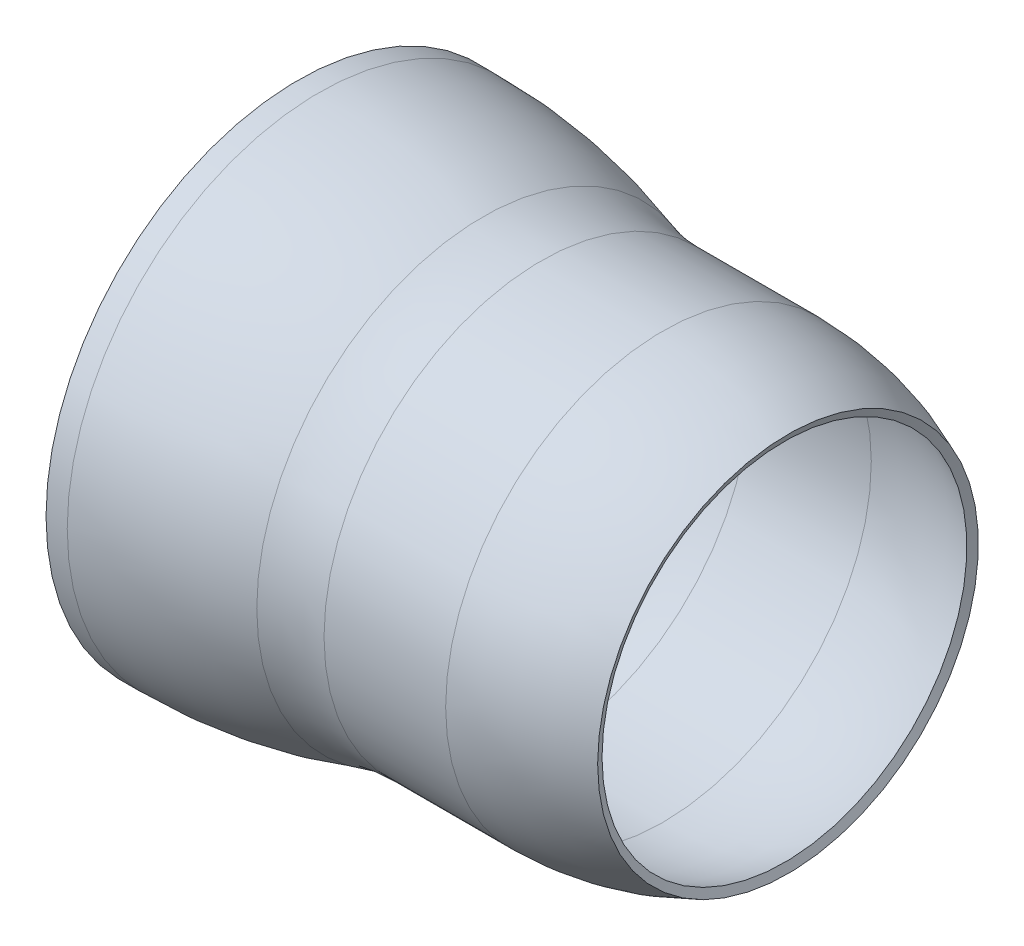
from build123d import *


with BuildPart() as part:
    # Sketch1 → Revolve1 (revolve)
    with BuildSketch(Plane.XY):
        with BuildLine():
            Line((0, 145), (0, 140))
            Line((0, 140), (12.208994244, 140))
            ThreePointArc((12.208994244, 140), (59.169265001, 136.347459879), (105, 125.477694091))
            ThreePointArc((105, 125.477694091), (122.286974227, 121.377708328), (140, 120.0000004))
            Line((140, 120.0000004), (210, 120.0000004))
            ThreePointArc((210, 120.0000004), (245.7945527, 116.207912702), (280, 105))
            Line((280, 105), (282.048780538, 109.560975587))
            ThreePointArc((282.048780538, 109.560975587), (246.84219817, 121.096924766), (210, 125.0000004))
            Line((210, 125.0000004), (140, 125.0000004))
            ThreePointArc((140, 125.0000004), (123.060090825, 126.317575808), (106.527637417, 130.238610381))
            ThreePointArc((106.527637417, 130.238610381), (59.942381599, 141.287327359), (12.208994244, 145))
            Line((12.208994244, 145), (0, 145))
        make_face()
    revolve(axis=Axis((0, 0, 0), (1, 0, 0)))


solid = part.part
